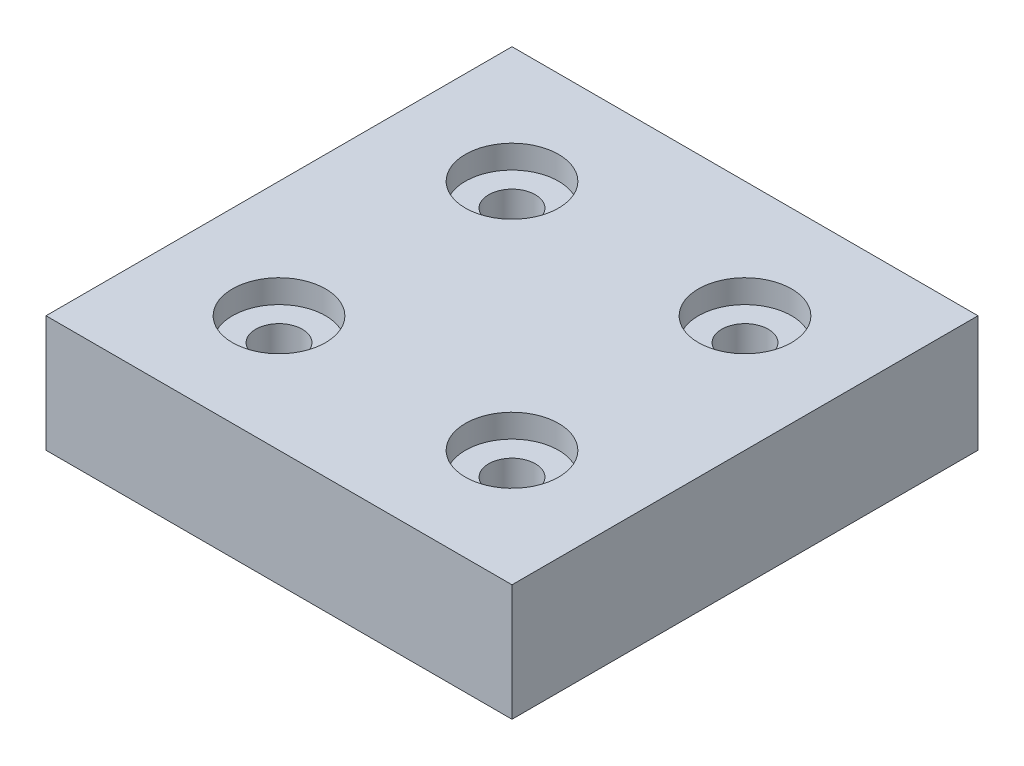
from build123d import *

# Parameters (mm, degrees)
SKETCH1_W           = 40
SKETCH1_H           = 40
SKETCH1_R           = 2
BOSS_EXTRUDE1_DEPTH = 10
SKETCH2_R           = 4
CUT_EXTRUDE1_DEPTH  = 2


with BuildPart() as part:
    # Sketch1 → Boss-Extrude1 (new body)
    with BuildSketch(Plane(origin=(0, 0, 0), x_dir=(1, 0, 0), z_dir=(0, 1, 0))):
        with Locations((20, 20)):
            Rectangle(SKETCH1_W, SKETCH1_H)
        with Locations((10, 30)):
            Circle(SKETCH1_R, mode=Mode.SUBTRACT)
        with Locations((30, 30)):
            Circle(SKETCH1_R, mode=Mode.SUBTRACT)
        with Locations((30, 10)):
            Circle(SKETCH1_R, mode=Mode.SUBTRACT)
        with Locations((10, 10)):
            Circle(SKETCH1_R, mode=Mode.SUBTRACT)
    extrude(amount=BOSS_EXTRUDE1_DEPTH)

    # Sketch2 → Cut-Extrude1 (cut)
    with BuildSketch(Plane(origin=(0, 10, 0), x_dir=(1, 0, 0), z_dir=(0, 1, 0))):
        with Locations((10, 10)):
            Circle(SKETCH2_R)
        with Locations((10, 30)):
            Circle(SKETCH2_R)
        with Locations((30, 30)):
            Circle(SKETCH2_R)
        with Locations((30, 10)):
            Circle(SKETCH2_R)
    extrude(amount=-CUT_EXTRUDE1_DEPTH, mode=Mode.SUBTRACT)


solid = part.part
